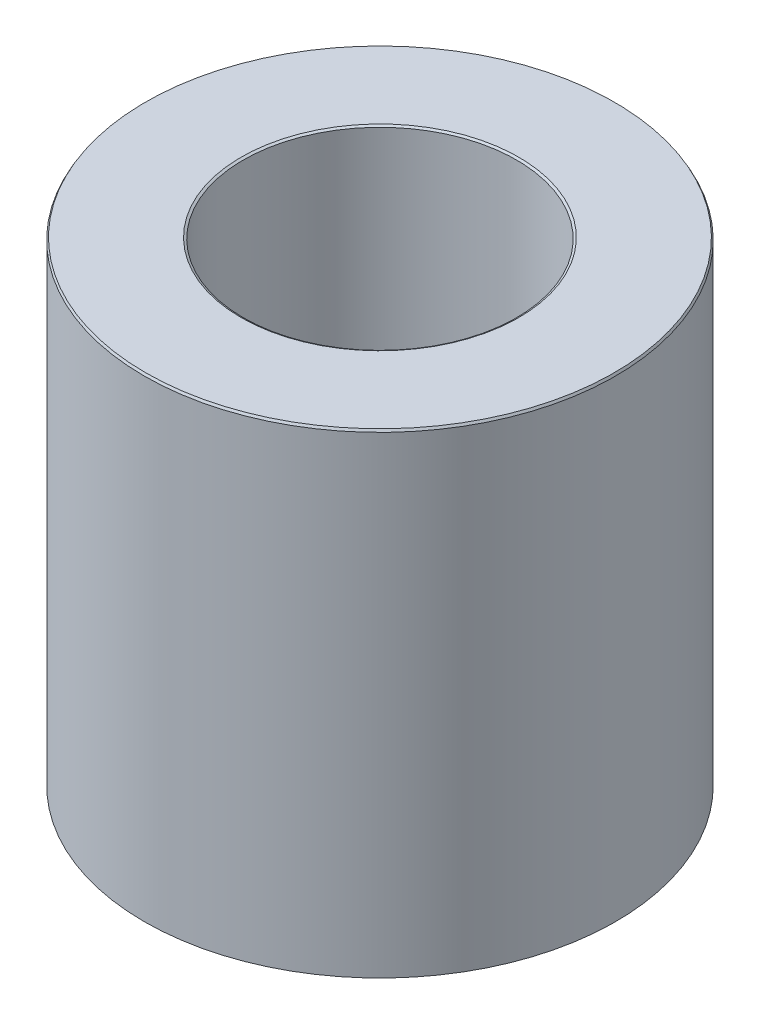
from build123d import *
from OCP.BRepFilletAPI import BRepFilletAPI_MakeChamfer

# Parameters (mm, degrees)
SKETCH1_R           = 47.5
BOSS_EXTRUDE1_DEPTH = 95.96121426
SKETCH2_R           = 27.542254568
CUT_EXTRUDE1_DEPTH  = 118.136905552
CHAMFER1_SIZE       = 0.453911764
CHAMFER1_SIZE2      = 0.254468341


with BuildPart() as part:
    # Sketch1 → Boss-Extrude1 (new body)
    with BuildSketch(Plane(origin=(0, 0, 0), x_dir=(1, 0, 0), z_dir=(0, 1, 0))):
        Circle(SKETCH1_R)
    extrude(amount=BOSS_EXTRUDE1_DEPTH)

    # Sketch2 → Cut-Extrude1 (cut, through all)
    with BuildSketch(Plane(origin=(0, 0, 0), x_dir=(1, 0, 0), z_dir=(0, 1, 0))):
        Circle(SKETCH2_R)
    extrude(amount=CUT_EXTRUDE1_DEPTH, mode=Mode.SUBTRACT)

    # Chamfer1: one chamfer whose edges measure the first distance from different faces: ONE call of the kernel's chamfer builder (chamfer() names one face for all edges)
    chamfer1_edges_1 = [part.edges().sort_by_distance(p)[0] for p in [
        (-27.542254568, 95.96121426, 0),
    ]]
    chamfer1_side_1 = [part.faces().sort_by_distance(p)[0] for p in [
        (-46.156497116, 95.96121426, 0),
    ]]
    chamfer1_edges_2 = [part.edges().sort_by_distance(p)[0] for p in [
        (-27.542254568, 0, 0),
    ]]
    chamfer1_side_2 = [part.faces().sort_by_distance(p)[0] for p in [
        (-27.542254568, 47.98060713, 0),
    ]]
    chamfer1_edges_3 = [part.edges().sort_by_distance(p)[0] for p in [
        (-47.5, 0, 0),
    ]]
    chamfer1_side_3 = [part.faces().sort_by_distance(p)[0] for p in [
        (-46.156497116, 0, 0),
    ]]
    chamfer1_edges_4 = [part.edges().sort_by_distance(p)[0] for p in [
        (-47.5, 95.96121426, 0),
    ]]
    chamfer1_side_4 = [part.faces().sort_by_distance(p)[0] for p in [
        (-47.5, 47.98060713, 0),
    ]]
    chamfer1 = BRepFilletAPI_MakeChamfer(part.part.solid().wrapped)
    for e in chamfer1_edges_1:
        chamfer1.Add(CHAMFER1_SIZE, CHAMFER1_SIZE2, e.wrapped, chamfer1_side_1[0].wrapped)  # the first distance lies on this face
    for e in chamfer1_edges_2:
        chamfer1.Add(CHAMFER1_SIZE, CHAMFER1_SIZE2, e.wrapped, chamfer1_side_2[0].wrapped)  # the first distance lies on this face
    for e in chamfer1_edges_3:
        chamfer1.Add(CHAMFER1_SIZE, CHAMFER1_SIZE2, e.wrapped, chamfer1_side_3[0].wrapped)  # the first distance lies on this face
    for e in chamfer1_edges_4:
        chamfer1.Add(CHAMFER1_SIZE, CHAMFER1_SIZE2, e.wrapped, chamfer1_side_4[0].wrapped)  # the first distance lies on this face
    add(Compound.cast(chamfer1.Shape()), mode=Mode.REPLACE)


solid = part.part
